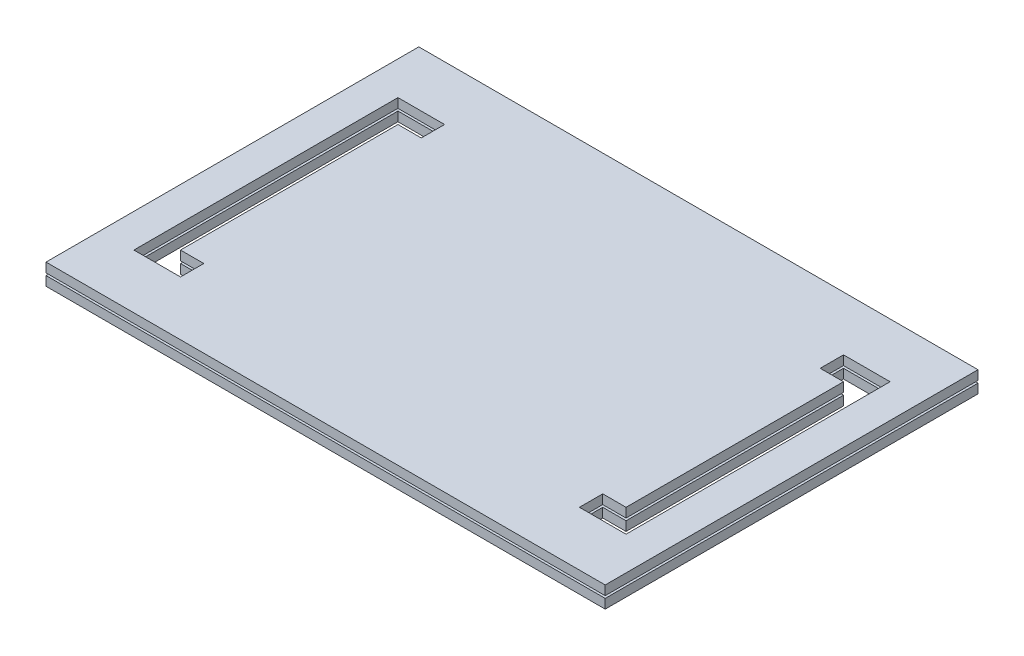
from build123d import *

# Parameters (mm, degrees)
SKETCH1_W           = 360
SKETCH1_H           = 240
BOSS_EXTRUDE1_DEPTH = 6
SKETCH1_3_W         = 360
SKETCH1_3_H         = 240
BOSS_EXTRUDE2_DEPTH = 6
SCALE1_START        = -120
SCALE1_OUTLINE_W    = 360
SCALE1_OUTLINE_H    = 12
SCALE1_OUTLINE_W_2  = 288
SCALE1_OUTLINE_H_2  = 4.8
SCALE1_DEPTH        = 240
SCALE1_2_OUTLINE_W  = 288
SCALE1_2_OUTLINE_H  = 4.8
SCALE1_2_DEPTH      = 24
SCALE1_START_2      = 96
SCALE1_3_OUTLINE_W  = 288
SCALE1_3_OUTLINE_H  = 4.8
SCALE1_3_DEPTH      = 24
SCALE1_START_3      = -68
SCALE1_4_OUTLINE_W  = 12
SCALE1_4_OUTLINE_H  = 4.8
SCALE1_4_DEPTH      = 136
SCALE1_5_OUTLINE_W  = 12
SCALE1_5_OUTLINE_H  = 4.8
SCALE1_5_DEPTH      = 12
SCALE1_START_4      = 56
SCALE1_6_OUTLINE_W  = 12
SCALE1_6_OUTLINE_H  = 4.8
SCALE1_6_DEPTH      = 12
SCALE1_START_5      = -85
SCALE1_7_OUTLINE_W  = 15.583612779
SCALE1_7_OUTLINE_H  = 4.8
SCALE1_7_DEPTH      = 170


# Read off the part's stored shape, not the designer's step: Scale1
with BuildPart() as part:
    # Sketch1 → Boss-Extrude1 (new body)
    with BuildSketch(Plane(origin=(0, 0, 0), x_dir=(1, 0, 0), z_dir=(0, 1, 0))):
        Rectangle(SKETCH1_W, SKETCH1_H)
        Polygon((-158.416387221, 85), (-128.416387221, 85), (-128.416387221, 70), (-143.416387221, 70), (-143.416387221, -70), (-128.416387221, -70), (-128.416387221, -85), (-158.416387221, -85), align=None, mode=Mode.SUBTRACT)
        Polygon((128.416387221, -70), (128.416387221, -85), (158.416387221, -85), (158.416387221, 85), (128.416387221, 85), (128.416387221, 70), (143.416387221, 70), (143.416387221, -70), align=None, mode=Mode.SUBTRACT)
    extrude(amount=BOSS_EXTRUDE1_DEPTH)


with BuildPart() as body_2:
    # Sketch1<3> → Boss-Extrude2 (new body)
    with BuildSketch(Plane(origin=(0, 0, 0), x_dir=(1, 0, 0), z_dir=(0, 1, 0))):
        Rectangle(SKETCH1_3_W, SKETCH1_3_H)
        Polygon((-158.416387221, 85), (-128.416387221, 85), (-128.416387221, 70), (-143.416387221, 70), (-143.416387221, -70), (-128.416387221, -70), (-128.416387221, -85), (-158.416387221, -85), align=None, mode=Mode.SUBTRACT)
        Polygon((128.416387221, -70), (128.416387221, -85), (158.416387221, -85), (158.416387221, 85), (128.416387221, 85), (128.416387221, 70), (143.416387221, 70), (143.416387221, -70), align=None, mode=Mode.SUBTRACT)
    extrude(amount=-BOSS_EXTRUDE2_DEPTH)


with BuildPart() as scale1_tool:
    # Scale1 outline → Scale1 (new body)
    with BuildSketch(Plane.XY.offset(SCALE1_START)):
        Rectangle(SCALE1_OUTLINE_W, SCALE1_OUTLINE_H)
        with Locations((0, 3)):
            Rectangle(SCALE1_OUTLINE_W_2, SCALE1_OUTLINE_H_2, mode=Mode.SUBTRACT)
        with Locations((0, -3)):
            Rectangle(SCALE1_OUTLINE_W_2, SCALE1_OUTLINE_H_2, mode=Mode.SUBTRACT)
    extrude(amount=SCALE1_DEPTH)


with BuildPart() as part_1:
    add(part.part)

    # Scale1: cut by scale1_tool
    add(scale1_tool.part, mode=Mode.SUBTRACT)


with BuildPart() as body_2_1:
    add(body_2.part)

    # Scale1: cut by scale1_tool
    add(scale1_tool.part, mode=Mode.SUBTRACT)


with BuildPart() as scale1_2_tool:
    # Scale1 2 outline → Scale1 2 (new body)
    with BuildSketch(Plane.XY.offset(SCALE1_START)):
        with Locations((0, 3)):
            Rectangle(SCALE1_2_OUTLINE_W, SCALE1_2_OUTLINE_H)
        with Locations((0, -3)):
            Rectangle(SCALE1_2_OUTLINE_W, SCALE1_2_OUTLINE_H)
    extrude(amount=SCALE1_2_DEPTH)


with BuildPart() as part_2:
    add(part_1.part)

    # Scale1 2: cut by scale1_2_tool
    add(scale1_2_tool.part, mode=Mode.SUBTRACT)


with BuildPart() as body_2_2:
    add(body_2_1.part)

    # Scale1 2: cut by scale1_2_tool
    add(scale1_2_tool.part, mode=Mode.SUBTRACT)


with BuildPart() as scale1_3_tool:
    # Scale1 3 outline → Scale1 3 (new body)
    with BuildSketch(Plane.XY.offset(SCALE1_START_2)):
        with Locations((0, 3)):
            Rectangle(SCALE1_3_OUTLINE_W, SCALE1_3_OUTLINE_H)
        with Locations((0, -3)):
            Rectangle(SCALE1_3_OUTLINE_W, SCALE1_3_OUTLINE_H)
    extrude(amount=SCALE1_3_DEPTH)


with BuildPart() as part_3:
    add(part_2.part)

    # Scale1 3: cut by scale1_3_tool
    add(scale1_3_tool.part, mode=Mode.SUBTRACT)


with BuildPart() as body_2_3:
    add(body_2_2.part)

    # Scale1 3: cut by scale1_3_tool
    add(scale1_3_tool.part, mode=Mode.SUBTRACT)


with BuildPart() as scale1_4_tool:
    # Scale1 4 outline → Scale1 4 (new body)
    with BuildSketch(Plane.XY.offset(SCALE1_START_3)):
        with Locations((-120.733109777, 3)):
            Rectangle(SCALE1_4_OUTLINE_W, SCALE1_4_OUTLINE_H)
        with Locations((120.733109777, 3)):
            Rectangle(SCALE1_4_OUTLINE_W, SCALE1_4_OUTLINE_H)
        with Locations((-120.733109777, -3)):
            Rectangle(SCALE1_4_OUTLINE_W, SCALE1_4_OUTLINE_H)
        with Locations((120.733109777, -3)):
            Rectangle(SCALE1_4_OUTLINE_W, SCALE1_4_OUTLINE_H)
    extrude(amount=SCALE1_4_DEPTH)


with BuildPart() as part_4:
    add(part_3.part)

    # Scale1 4: cut by scale1_4_tool
    add(scale1_4_tool.part, mode=Mode.SUBTRACT)


with BuildPart() as body_2_4:
    add(body_2_3.part)

    # Scale1 4: cut by scale1_4_tool
    add(scale1_4_tool.part, mode=Mode.SUBTRACT)


with BuildPart() as scale1_5_tool:
    # Scale1 5 outline → Scale1 5 (new body)
    with BuildSketch(Plane.XY.offset(SCALE1_START_3)):
        with Locations((-108.733109777, 3)):
            Rectangle(SCALE1_5_OUTLINE_W, SCALE1_5_OUTLINE_H)
        with Locations((108.733109777, 3)):
            Rectangle(SCALE1_5_OUTLINE_W, SCALE1_5_OUTLINE_H)
        with Locations((-108.733109777, -3)):
            Rectangle(SCALE1_5_OUTLINE_W, SCALE1_5_OUTLINE_H)
        with Locations((108.733109777, -3)):
            Rectangle(SCALE1_5_OUTLINE_W, SCALE1_5_OUTLINE_H)
    extrude(amount=SCALE1_5_DEPTH)


with BuildPart() as part_5:
    add(part_4.part)

    # Scale1 5: cut by scale1_5_tool
    add(scale1_5_tool.part, mode=Mode.SUBTRACT)


with BuildPart() as body_2_5:
    add(body_2_4.part)

    # Scale1 5: cut by scale1_5_tool
    add(scale1_5_tool.part, mode=Mode.SUBTRACT)


with BuildPart() as scale1_6_tool:
    # Scale1 6 outline → Scale1 6 (new body)
    with BuildSketch(Plane.XY.offset(SCALE1_START_4)):
        with Locations((-108.733109777, 3)):
            Rectangle(SCALE1_6_OUTLINE_W, SCALE1_6_OUTLINE_H)
        with Locations((108.733109777, 3)):
            Rectangle(SCALE1_6_OUTLINE_W, SCALE1_6_OUTLINE_H)
        with Locations((-108.733109777, -3)):
            Rectangle(SCALE1_6_OUTLINE_W, SCALE1_6_OUTLINE_H)
        with Locations((108.733109777, -3)):
            Rectangle(SCALE1_6_OUTLINE_W, SCALE1_6_OUTLINE_H)
    extrude(amount=SCALE1_6_DEPTH)


with BuildPart() as part_6:
    add(part_5.part)

    # Scale1 6: cut by scale1_6_tool
    add(scale1_6_tool.part, mode=Mode.SUBTRACT)



with BuildPart() as body_2_6:
    add(body_2_5.part)

    # Scale1 6: cut by scale1_6_tool
    add(scale1_6_tool.part, mode=Mode.SUBTRACT)


with BuildPart() as part_7:
    add(part_6.part)

    add(body_2_6.part)  # Scale1 7 merges body 2
    # Scale1 7 outline → Scale1 7 (add)
    with BuildSketch(Plane.XY.offset(SCALE1_START_5)):
        with Locations((-136.208193611, 3)):
            Rectangle(SCALE1_7_OUTLINE_W, SCALE1_7_OUTLINE_H)
        with Locations((136.208193611, 3)):
            Rectangle(SCALE1_7_OUTLINE_W, SCALE1_7_OUTLINE_H)
        with Locations((-136.208193611, -3)):
            Rectangle(SCALE1_7_OUTLINE_W, SCALE1_7_OUTLINE_H)
        with Locations((136.208193611, -3)):
            Rectangle(SCALE1_7_OUTLINE_W, SCALE1_7_OUTLINE_H)
    extrude(amount=SCALE1_7_DEPTH)


solid = part_7.part
